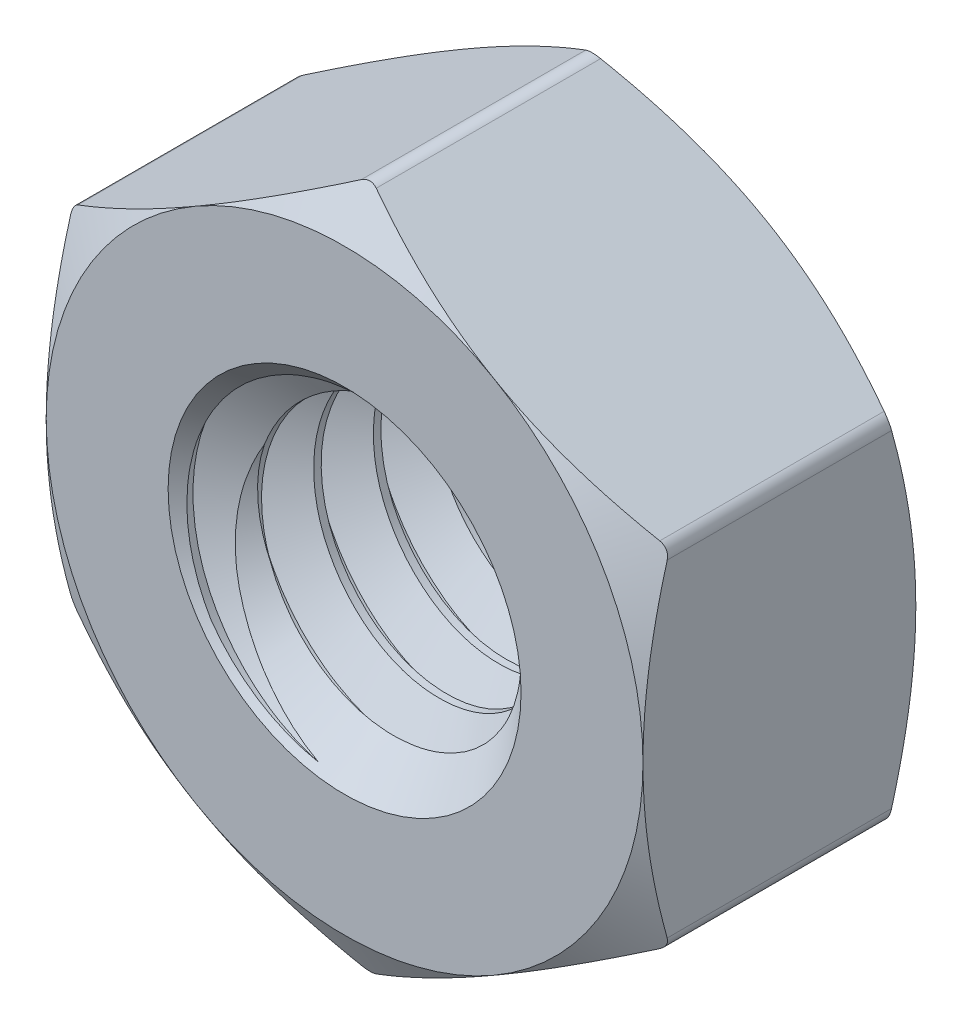
from build123d import *

# Parameters (mm, degrees)
BOSS_EXTRUDE2_DEPTH     = 1.6
CUT_EXTRUDE4_DEPTH      = 6.580621232
CUT_EXTRUDE4_DEPTH_BACK = 6.580621232
SKETCH16_R              = 2
SKETCH7_OUTSIDE_W       = 36.28
SKETCH7_OUTSIDE_H       = 37.362
SKETCH7_OUTSIDE_R       = 3.5
CUT_EXTRUDE5_DEPTH      = 7.23083729
CUT_EXTRUDE5_DRAFT      = -60
MIRROR4_COPY_1_SKETCH_W = 36.28
MIRROR4_COPY_1_SKETCH_H = 37.362
MIRROR4_COPY_1_SKETCH_R = 3.5
MIRROR4_COPY_1_DEPTH    = 7.23083729
MIRROR4_COPY_1_DRAFT    = -60
FILLET2_R               = 0.175
SKETCH13_R              = 2
BOSS_EXTRUDE1_DEPTH     = 3.2
CUT_SWEEP1_PITCH        = 0.7
SKETCH17_R              = 2
BOSS_EXTRUDE3_DEPTH     = 3.2


with BuildPart() as part:
    # Sketch15 → Boss-Extrude2 (new, symmetric)
    with BuildSketch(Plane.XY):
        Polygon((0, 4.041451884), (-3.5, 2.020725942), (-3.5, -2.020725942), (0, -4.041451884), (3.5, -2.020725942), (3.5, 2.020725942), align=None)
    extrude(amount=BOSS_EXTRUDE2_DEPTH, both=True)

    # Sketch16 → Cut-Extrude4 (cut, two sides: drawn at the far end of the back side and taken through both)
    with BuildSketch(Plane.XY.offset(-CUT_EXTRUDE4_DEPTH_BACK)):
        Circle(SKETCH16_R)
    extrude(amount=CUT_EXTRUDE4_DEPTH + CUT_EXTRUDE4_DEPTH_BACK, mode=Mode.SUBTRACT)


with BuildPart() as cut_extrude5_tool:
    # Sketch7 outside → Cut-Extrude5 (with draft: the straight prism first)
    with BuildSketch(Plane.XY.offset(1.6)):
        Rectangle(SKETCH7_OUTSIDE_W, SKETCH7_OUTSIDE_H)
        Circle(SKETCH7_OUTSIDE_R, mode=Mode.SUBTRACT)
    extrude(amount=-CUT_EXTRUDE5_DEPTH)
    # Cut-Extrude5: the draft: its side faces are tilted about the plane it starts from
    cut_extrude5_sides = [cut_extrude5_tool.faces().sort_by_distance(p)[0] for p in [
        (0, -18.681, -2.015418645),
        (18.14, 0, -2.015418645),
        (0, 18.681, -2.015418645),
        (-18.14, 0, -2.015418645),
        (-3.5, 0, -2.015418645),
    ]]
    draft(cut_extrude5_sides, Plane.XY.offset(1.6), CUT_EXTRUDE5_DRAFT)


with BuildPart() as part_1:
    add(part.part)

    # Cut-Extrude5: cut by cut_extrude5_tool
    add(cut_extrude5_tool.part, mode=Mode.SUBTRACT)


with BuildPart() as mirror4_copy_1_tool:
    # Mirror4 copy 1 sketch → Mirror4 copy 1 (with draft: the straight prism first)
    with BuildSketch(Plane(origin=(0, 0, -1.6), x_dir=(1, 0, 0), z_dir=(0, 0, -1))):
        Rectangle(MIRROR4_COPY_1_SKETCH_W, MIRROR4_COPY_1_SKETCH_H)
        Circle(MIRROR4_COPY_1_SKETCH_R, mode=Mode.SUBTRACT)
    extrude(amount=-MIRROR4_COPY_1_DEPTH)
    # Mirror4 copy 1: the draft: its side faces are tilted about the plane it starts from
    mirror4_copy_1_sides = [mirror4_copy_1_tool.faces().sort_by_distance(p)[0] for p in [
        (0, -18.681, 2.015418645),
        (18.14, 0, 2.015418645),
        (0, 18.681, 2.015418645),
        (-18.14, 0, 2.015418645),
        (-3.5, 0, 2.015418645),
    ]]
    draft(mirror4_copy_1_sides, Plane(origin=(0, 0, -1.6), x_dir=(1, 0, 0), z_dir=(0, 0, -1)), MIRROR4_COPY_1_DRAFT)


with BuildPart() as part_2:
    add(part_1.part)

    # Mirror4 copy 1: cut by mirror4_copy_1_tool
    add(mirror4_copy_1_tool.part, mode=Mode.SUBTRACT)

    # Fillet2
    fillet2_edges = [part_2.edges().sort_by_distance(p)[0] for p in [
        (-3.5, 2.020725942, 0),
        (-3.5, -2.020725942, 0),
        (0, -4.041451884, 0),
        (3.5, -2.020725942, 0),
        (3.5, 2.020725942, 0),
        (0, 4.041451884, 0),
    ]]
    fillet(fillet2_edges, radius=FILLET2_R)

    # Sketch17 → Boss-Extrude3 (add)
    with BuildSketch(Plane.XY.offset(1.6)):
        Circle(SKETCH17_R)
    extrude(amount=-BOSS_EXTRUDE3_DEPTH)


with BuildPart() as body_2:
    # Sketch13 → Boss-Extrude1 (new body)
    with BuildSketch(Plane(origin=(0, 0, -1.6), x_dir=(-1, 0, 0), z_dir=(0, 0, -1))):
        Circle(SKETCH13_R)
    extrude(amount=-BOSS_EXTRUDE1_DEPTH)

    # Cut-Sweep1: arcs per turn and ends read off the stored shape
    # Cut-Sweep1: the profile of Sketch12 profile screwed along a right-hand helix through 6.666667 turns, 6 arcs to a turn; built about Z, then put on its axis
    cut_sweep1_z = Axis((0, 0, 0), (0, 0, 1))
    cut_sweep1_corners = [(2.0003, 0, -1.312673205), (2.0003, 0, -0.699826795), (1.545336663, 0, -0.9625), (1.545336663, 0, -1.05)]
    with BuildLine(mode=Mode.PRIVATE) as cut_sweep1_profile:
        Line(cut_sweep1_corners[0], cut_sweep1_corners[1])
        Line(cut_sweep1_corners[1], cut_sweep1_corners[2])
        Line(cut_sweep1_corners[2], cut_sweep1_corners[3])
        Line(cut_sweep1_corners[3], cut_sweep1_corners[0])
    cut_sweep1_cap = Face(cut_sweep1_profile.wire())
    cut_sweep1_turn_angles = [0, 30, 60, 90, 120, 150, 180, 210, 240, 270, 300, 330, 360]
    cut_sweep1_turn_weights = [1, 0.8660254037844387, 1, 0.8660254037844387, 1, 0.8660254037844387, 1, 0.8660254037844387, 1, 0.8660254037844387, 1, 0.8660254037844387, 1]
    cut_sweep1_turn_rails = [Edge.make_bspline([Vector(p[0], p[1], 0).rotate(cut_sweep1_z, cut_sweep1_turn_angles[k]) / cut_sweep1_turn_weights[k] + Vector(0, 0, p[2] + CUT_SWEEP1_PITCH * cut_sweep1_turn_angles[k] / 360) for k in range(13)], [0, 0, 0, 1, 1, 2, 2, 3, 3, 4, 4, 5, 5, 6, 6, 6], 2, cut_sweep1_turn_weights) for p in cut_sweep1_corners]
    cut_sweep1_turn_sides = [Face.make_surface_from_curves(cut_sweep1_turn_rails[p[0]], cut_sweep1_turn_rails[p[1]]) for p in [(0, 1), (1, 2), (2, 3), (3, 0)]]
    cut_sweep1_last_angles = [2160, 2190, 2220, 2250, 2280, 2310, 2340, 2370, 2400]
    cut_sweep1_last_weights = [1, 0.8660254037844387, 1, 0.8660254037844387, 1, 0.8660254037844387, 1, 0.8660254037844387, 1]
    cut_sweep1_last_rails = [Edge.make_bspline([Vector(p[0], p[1], 0).rotate(cut_sweep1_z, cut_sweep1_last_angles[k]) / cut_sweep1_last_weights[k] + Vector(0, 0, p[2] + CUT_SWEEP1_PITCH * cut_sweep1_last_angles[k] / 360) for k in range(9)], [0, 0, 0, 1, 1, 2, 2, 3, 3, 4, 4, 4], 2, cut_sweep1_last_weights) for p in cut_sweep1_corners]
    cut_sweep1_last_sides = [Face.make_surface_from_curves(cut_sweep1_last_rails[p[0]], cut_sweep1_last_rails[p[1]]) for p in [(0, 1), (1, 2), (2, 3), (3, 0)]]
    cut_sweep1 = Plane(origin=(0, 0, -1.6), x_dir=(0, 1, 0), z_dir=(0, 0, 1)) * Solid(Shell([*[p.moved(Location((0, 0, CUT_SWEEP1_PITCH * i))) for i in range(6) for p in cut_sweep1_turn_sides], *cut_sweep1_last_sides, cut_sweep1_cap, cut_sweep1_cap.rotate(cut_sweep1_z, 2400).moved(Location((0, 0, CUT_SWEEP1_PITCH * 2400 / 360)))]))
    add(cut_sweep1, mode=Mode.SUBTRACT)


with BuildPart() as part_3:
    add(part_2.part)

    # Combine1: cut body 2
    add(body_2.part, mode=Mode.SUBTRACT)

    # Cut-Extrude2 cone 1 section (through the dimple's axis) → Cut-Extrude2 (revolve, cut)
    with BuildSketch(Plane(origin=(0, 0, 1.6), x_dir=(0, -1, 0), z_dir=(1, 0, 0))):
        Polygon((0, 0), (2.07, 0), (0, 2.07), align=None)
    revolve(axis=Axis((0, 0, 1.6), (0, 0, -1)), mode=Mode.SUBTRACT)

    # Cut-Extrude3 cone 1 section (through the dimple's axis) → Cut-Extrude3 (revolve, cut)
    with BuildSketch(Plane(origin=(0, 0, -1.6), x_dir=(0, 1, 0), z_dir=(1, 0, 0))):
        Polygon((0, 0), (2.07, 0), (0, 2.07), align=None)
    revolve(axis=Axis((0, 0, -1.6), (0, 0, 1)), mode=Mode.SUBTRACT)


solid = part_3.part
